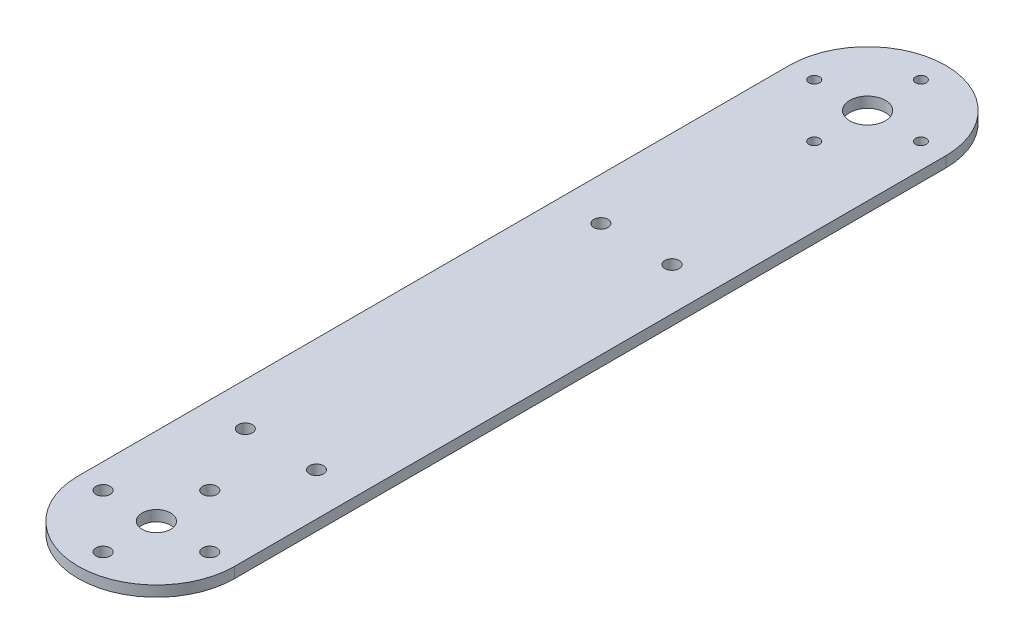
from build123d import *

# Parameters (mm, degrees)
SKETCH_1_R             = 4
SKETCH_1_R_2           = 2
SKETCH_1_R_3           = 5
SKETCH_1_R_4           = 1.5
SM_BASE_FLANGE_1_DEPTH = 3


# Sheet-metal steps are written as plain solids
with BuildPart() as part:
    # Sketch 1 → 基体-法兰1 (new body)
    with BuildSketch(Plane(origin=(0, 0, 0), x_dir=(1, 0, 0), z_dir=(0, 1, 0))):
        with BuildLine():
            Line((22, 200), (22, 0))
            ThreePointArc((22, 0), (0, -22), (-22, 0))
            Line((-22, 0), (-22, 200))
            ThreePointArc((-22, 200), (0, 222), (22, 200))
        make_face()
        with Locations(Location((0, 0, 0), (0, 0, 270))):
            Circle(SKETCH_1_R, mode=Mode.SUBTRACT)
        with Locations(Location((-10, 35, 0), (0, 0, 270))):
            Circle(SKETCH_1_R_2, mode=Mode.SUBTRACT)
        with Locations(Location((10, 35, 0), (0, 0, 270))):
            Circle(SKETCH_1_R_2, mode=Mode.SUBTRACT)
        with Locations(Location((-10, 135, 0), (0, 0, 270))):
            Circle(SKETCH_1_R_2, mode=Mode.SUBTRACT)
        with Locations(Location((10, 135, 0), (0, 0, 270))):
            Circle(SKETCH_1_R_2, mode=Mode.SUBTRACT)
        with Locations(Location((0, 200, 0), (0, 0, 270))):
            Circle(SKETCH_1_R_3, mode=Mode.SUBTRACT)
        with Locations(Location((0, 215, 0), (0, 0, 270))):
            Circle(SKETCH_1_R_4, mode=Mode.SUBTRACT)
        with Locations(Location((15, 200, 0), (0, 0, 270))):
            Circle(SKETCH_1_R_4, mode=Mode.SUBTRACT)
        with Locations(Location((0, 185, 0), (0, 0, 270))):
            Circle(SKETCH_1_R_4, mode=Mode.SUBTRACT)
        with Locations(Location((-15, 200, 0), (0, 0, 270))):
            Circle(SKETCH_1_R_4, mode=Mode.SUBTRACT)
        with Locations(Location((0, 15, 0), (0, 0, 270))):
            Circle(SKETCH_1_R_2, mode=Mode.SUBTRACT)
        with Locations(Location((15, 0, 0), (0, 0, 270))):
            Circle(SKETCH_1_R_2, mode=Mode.SUBTRACT)
        with Locations(Location((0, -15, 0), (0, 0, 270))):
            Circle(SKETCH_1_R_2, mode=Mode.SUBTRACT)
        with Locations(Location((-15, 0, 0), (0, 0, 270))):
            Circle(SKETCH_1_R_2, mode=Mode.SUBTRACT)
    extrude(amount=-SM_BASE_FLANGE_1_DEPTH)


solid = part.part
